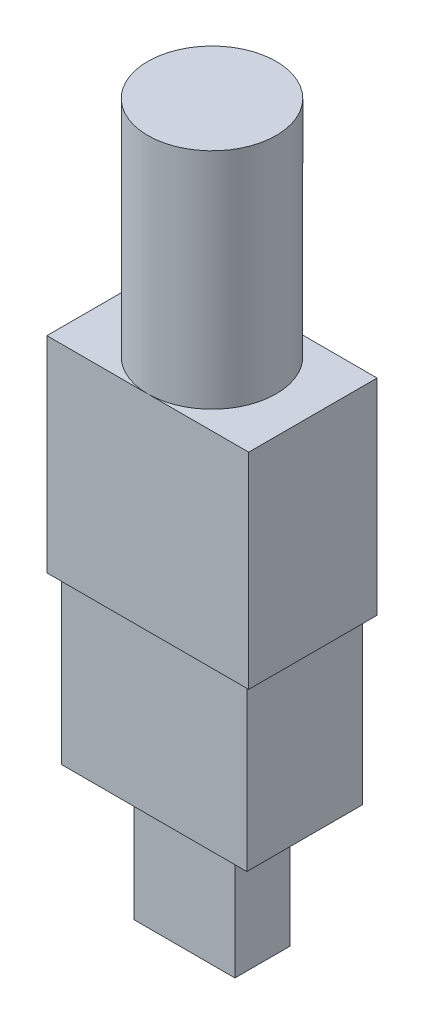
from build123d import *

# Parameters (mm, degrees)
SKETCH1_W           = 5.5
SKETCH1_H           = 3
BOSS_EXTRUDE1_DEPTH = 7
SKETCH2_W           = 10.1
SKETCH2_H           = 6.3
BOSS_EXTRUDE2_DEPTH = 9
SKETCH3_W           = 11
SKETCH3_H           = 7
BOSS_EXTRUDE3_DEPTH = 11.2
SKETCH4_R           = 3.5
BOSS_EXTRUDE4_DEPTH = 12.2


with BuildPart() as part:
    # Sketch1 → Boss-Extrude1 (new body)
    with BuildSketch(Plane(origin=(0, 0, 0), x_dir=(1, 0, 0), z_dir=(0, 1, 0))):
        with Locations((2.75, 1.5)):
            Rectangle(SKETCH1_W, SKETCH1_H)
    extrude(amount=BOSS_EXTRUDE1_DEPTH)

    # Sketch2 → Boss-Extrude2 (add)
    with BuildSketch(Plane(origin=(0, 7, 0), x_dir=(1, 0, 0), z_dir=(0, 1, 0))):
        with Locations((2.75, 1.5)):
            Rectangle(SKETCH2_W, SKETCH2_H)
    extrude(amount=BOSS_EXTRUDE2_DEPTH)

    # Sketch3 → Boss-Extrude3 (add)
    with BuildSketch(Plane(origin=(0, 16, 0), x_dir=(1, 0, 0), z_dir=(0, 1, 0))):
        with Locations((2.75, 1.5)):
            Rectangle(SKETCH3_W, SKETCH3_H)
    extrude(amount=BOSS_EXTRUDE3_DEPTH)

    # Sketch4 → Boss-Extrude4 (add)
    with BuildSketch(Plane(origin=(0, 27.2, 0), x_dir=(1, 0, 0), z_dir=(0, 1, 0))):
        with Locations((2.75, 1.5)):
            Circle(SKETCH4_R)
    extrude(amount=BOSS_EXTRUDE4_DEPTH)


solid = part.part
